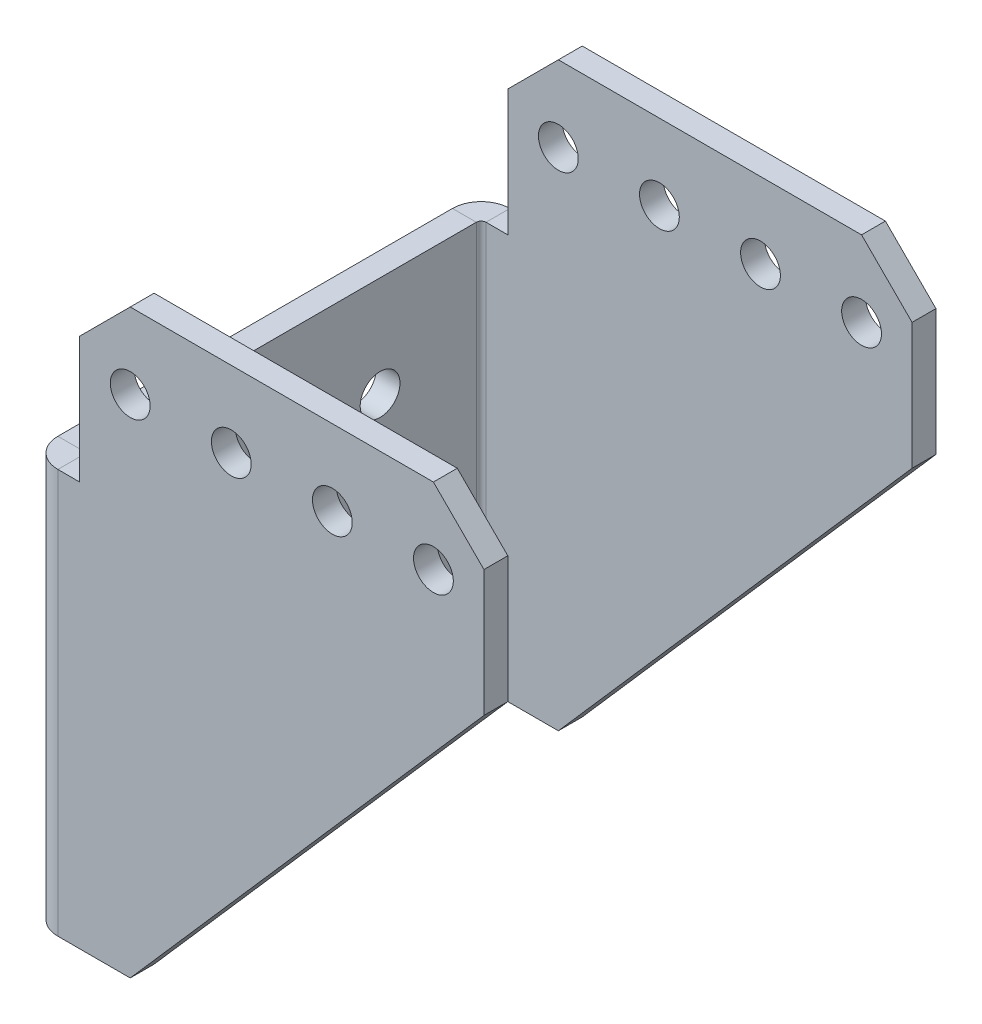
from build123d import *

# Parameters (mm, degrees)
SKETCH7_W               = 50.8
SKETCH7_H               = 49.5808
BASE_FLANGE1_DEPTH      = 3
F_10_CLEARANCE_HOLE1_D  = 5
EDGE_FLANGE1_DEPTH      = 50.8
EDGE_FLANGE1_START      = 3
EDGE_FLANGE1_PROFILE_R  = 2.5
EDGE_FLANGE1_FLAT_DEPTH = 3
EDGE_FLANGE2_DEPTH      = 50.8
EDGE_FLANGE2_START      = 3
EDGE_FLANGE2_PROFILE_R  = 2.5
EDGE_FLANGE2_FLAT_DEPTH = 3


# Sheet-metal steps are written as plain solids
with BuildPart() as part:
    # Sketch7 → Base-Flange1 (new body)
    with BuildSketch(Plane(origin=(0, 0, 0), x_dir=(0, -1, 0), z_dir=(-1, 0, 0))):
        with Locations((-25.4, -28.4)):
            Rectangle(SKETCH7_W, SKETCH7_H)
    extrude(amount=-BASE_FLANGE1_DEPTH)

    # #10 Clearance Hole1 (through all)
    with Locations(Plane(origin=(3, 0, 0), x_dir=(0, 0, -1), z_dir=(1, 0, 0))):
        with Locations((41.1, 12.7), (41.1, 25.4), (28.4, 25.4), (28.4, 12.7), (15.7, 12.7), (15.7, 25.4), (15.7, 38.1), (28.4, 38.1), (41.1, 38.1)):
            Hole(F_10_CLEARANCE_HOLE1_D / 2)

    # Edge-Flange1 bend section (across the edge) → Edge-Flange1 (add)
    with BuildSketch(Plane(origin=(3, 0, -53.8), x_dir=(0, 0, 1), z_dir=(0, 1, 0))):
        with BuildLine():
            Line((-3, 0.6096), (0, 0.6096))
            ThreePointArc((0, 0.6096), (0.178547706, 0.178547706), (0.6096, 0))
            Line((0.6096, 0), (0.6096, -3))
            ThreePointArc((0.6096, -3), (-1.942772637, -1.942772637), (-3, 0.6096))
        make_face()
    extrude(amount=EDGE_FLANGE1_DEPTH)

    # Edge-Flange1 profile (on flange) → Edge-Flange1 flat (add)
    with BuildSketch(Plane(origin=(3, 0, -53.8), x_dir=(0, 1, 0), z_dir=(0, 0, -1)).offset(EDGE_FLANGE1_START)):
        Polygon((0, 0.6096), (50.8, 0.6096), (50.8, 3.35), (66.675, 3.35), (73.025, 9.7), (73.025, 47.8), (66.675, 54.15), (50.8, 54.15), (0, 9.7), align=None)
        with Locations((63.5, 9.7)):
            Circle(EDGE_FLANGE1_PROFILE_R, mode=Mode.SUBTRACT)
        with Locations((63.5, 22.4)):
            Circle(EDGE_FLANGE1_PROFILE_R, mode=Mode.SUBTRACT)
        with Locations((63.5, 35.1)):
            Circle(EDGE_FLANGE1_PROFILE_R, mode=Mode.SUBTRACT)
        with Locations((63.5, 47.8)):
            Circle(EDGE_FLANGE1_PROFILE_R, mode=Mode.SUBTRACT)
    extrude(amount=-EDGE_FLANGE1_FLAT_DEPTH)

    # Edge-Flange2 bend section (across the edge) → Edge-Flange2 (add)
    with BuildSketch(Plane(origin=(3, 50.8, -3), x_dir=(0, 0, -1), z_dir=(0, -1, 0))):
        with BuildLine():
            Line((-3, 0.6096), (0, 0.6096))
            ThreePointArc((0, 0.6096), (0.178547706, 0.178547706), (0.6096, 0))
            Line((0.6096, 0), (0.6096, -3))
            ThreePointArc((0.6096, -3), (-1.942772637, -1.942772637), (-3, 0.6096))
        make_face()
    extrude(amount=EDGE_FLANGE2_DEPTH)

    # Edge-Flange2 profile (on flange) → Edge-Flange2 flat (add)
    with BuildSketch(Plane(origin=(3, 0, -3), x_dir=(0, -1, 0), z_dir=(0, 0, 1)).offset(EDGE_FLANGE2_START)):
        Polygon((0, 0.6096), (0, 9.7), (-50.8, 54.15), (-66.675, 54.15), (-73.025, 47.8), (-73.025, 9.7), (-66.675, 3.35), (-50.8, 3.35), (-50.8, 0.6096), align=None)
        with Locations((-63.5, 9.7)):
            Circle(EDGE_FLANGE2_PROFILE_R, mode=Mode.SUBTRACT)
        with Locations((-63.5, 22.4)):
            Circle(EDGE_FLANGE2_PROFILE_R, mode=Mode.SUBTRACT)
        with Locations((-63.5, 35.1)):
            Circle(EDGE_FLANGE2_PROFILE_R, mode=Mode.SUBTRACT)
        with Locations((-63.5, 47.8)):
            Circle(EDGE_FLANGE2_PROFILE_R, mode=Mode.SUBTRACT)
    extrude(amount=-EDGE_FLANGE2_FLAT_DEPTH)


solid = part.part
